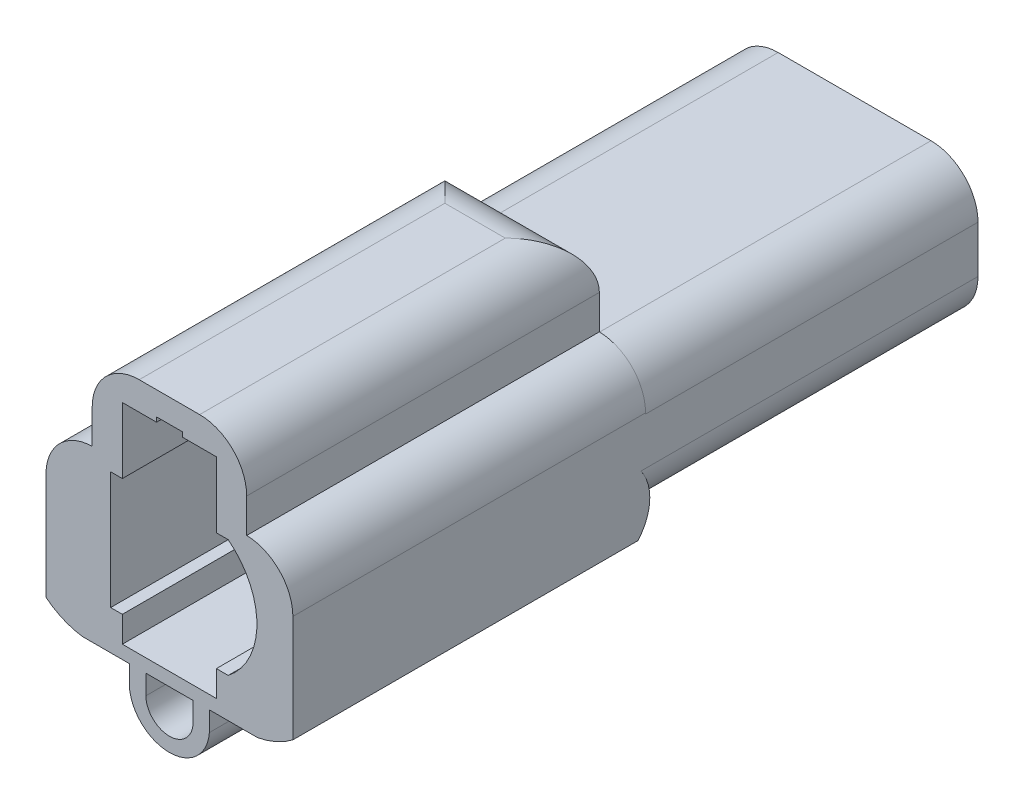
from build123d import *

# Parameters (mm, degrees)
SKETCH1_W            = 10.5
SKETCH1_H            = 6
BOSS_EXTRUDE1_DEPTH  = 7.07
SKETCH3_W            = 8.6
SKETCH3_H            = 1.8
CUT_EXTRUDE2_DEPTH   = 17
SKETCH4_W            = 10.5
SKETCH4_H            = 6
BOSS_EXTRUDE2_DEPTH  = 7.07
SKETCH5_W            = 4
SKETCH5_H            = 1.8
CUT_EXTRUDE3_DEPTH   = 19
FILLET1_R            = 12
FILLET2_R            = 12
SKETCH19_W           = 10.5
SKETCH19_H           = 11
SKETCH19_W_2         = 4
SKETCH19_H_2         = 1.8
BOSS_EXTRUDE8_DEPTH  = 15
CUT_EXTRUDE8_DEPTH   = 14.5
SKETCH21_W           = 10.5
SKETCH21_H           = 15
BOSS_EXTRUDE9_DEPTH  = 1
CUT_EXTRUDE10_DEPTH  = 15
FILLET6_R            = 2
FILLET12_R           = 2
BOSS_EXTRUDE15_DEPTH = 13
FILLET15_R           = 2
FILLET16_R           = 2
FILLET17_R           = 2


with BuildPart() as part:
    # Sketch1 → Boss-Extrude1 (new body)
    with BuildSketch(Plane.XY):
        Rectangle(SKETCH1_W, SKETCH1_H)
    extrude(amount=BOSS_EXTRUDE1_DEPTH)

    # Sketch3 → Cut-Extrude2 (cut)
    with BuildSketch(Plane.XY.offset(7.07)):
        Rectangle(SKETCH3_W, SKETCH3_H)
    extrude(amount=-CUT_EXTRUDE2_DEPTH, mode=Mode.SUBTRACT)

    # Sketch4 → Boss-Extrude2 (add)
    with BuildSketch(Plane.XY.offset(7.07)):
        Rectangle(SKETCH4_W, SKETCH4_H)
    extrude(amount=BOSS_EXTRUDE2_DEPTH)

    # Sketch5 → Cut-Extrude3 (cut, symmetric)
    with BuildSketch(Plane.XY.offset(14.14)):
        Rectangle(SKETCH5_W, SKETCH5_H)
    extrude(amount=CUT_EXTRUDE3_DEPTH, both=True, mode=Mode.SUBTRACT)

    # Fillet1
    # the kernel refuses this fillet: 12 mm, written as the material it takes off along each edge
    with BuildSketch(Plane(origin=(2, -0.9, 7.07), x_dir=(1, 0, 0), z_dir=(0, 1, 0))) as fillet1_piece_1:
        with BuildLine():
            CenterArc((12, -7.064700984), FILLET1_R, 143.93341174, 36.06658826)
            Line((0, -7.064700984), (0, 0))
            Line((0, 0), (2.3, 0))
        make_face()
    extrude(amount=1.8, mode=Mode.SUBTRACT)

    # Fillet2
    # the kernel refuses this fillet: 12 mm, written as the material it takes off along each edge
    with BuildSketch(Plane(origin=(-2, 0.9, 7.07), x_dir=(0, 0, 1), z_dir=(0, -1, 0))) as fillet2_piece_1:
        with BuildLine():
            CenterArc((7.064700984, 12), FILLET2_R, 233.93341174, 36.06658826)
            Line((0, 2.3), (0, 0))
            Line((0, 0), (7.064700984, 0))
        make_face()
    extrude(amount=1.8, mode=Mode.SUBTRACT)

    # Sketch19 → Boss-Extrude8 (add)
    with BuildSketch(Plane.XY.offset(14.14)):
        Rectangle(SKETCH19_W, SKETCH19_H)
        Rectangle(SKETCH19_W_2, SKETCH19_H_2, mode=Mode.SUBTRACT)
    extrude(amount=BOSS_EXTRUDE8_DEPTH)

    # Sketch20 → Cut-Extrude8 (cut)
    with BuildSketch(Plane.XY.offset(29.14)):
        with BuildLine():
            Line((1.996194266, 2.5), (1.996194266, 3.60169129))
            Line((1.996194266, 3.60169129), (1.996194266, 5.301713665))
            Line((1.996194266, 5.301713665), (0.55, 5.301713665))
            Line((0.55, 5.301713665), (0.55, 5.5))
            Line((0.55, 5.5), (-0.55, 5.5))
            Line((-0.55, 5.5), (-0.55, 5.301713665))
            Line((-0.55, 5.301713665), (-2.002287503, 5.301713665))
            Line((-2.002287503, 5.301713665), (-2.002287503, 2.5))
            Line((-2.002287503, 2.5), (-2.5, 2.5))
            Line((-2.5, 2.5), (-2.5, -2.5))
            Line((-2.5, -2.5), (-2.002287503, -2.5))
            Line((-2.002287503, -2.5), (-2.002287503, -3.60169129))
            Line((-2.002287503, -3.60169129), (0, -3.60169129))
            Line((0, -3.60169129), (1.996194266, -3.60169129))
            Line((1.996194266, -3.60169129), (1.996194266, -2.5))
            Line((1.996194266, -2.5), (2.5, -2.5))
            ThreePointArc((2.5, -2.5), (3.720567772, 0), (2.5, 2.5))
            Line((2.5, 2.5), (1.996194266, 2.5))
        make_face()
    extrude(amount=-CUT_EXTRUDE8_DEPTH, mode=Mode.SUBTRACT)

    # Sketch21 → Boss-Extrude9 (add)
    with BuildSketch(Plane(origin=(0, 5.5, 0), x_dir=(1, 0, 0), z_dir=(0, 1, 0))):
        with Locations((0, -21.64)):
            Rectangle(SKETCH21_W, SKETCH21_H)
    extrude(amount=BOSS_EXTRUDE9_DEPTH)

    # Sketch22 → Cut-Extrude10 (cut)
    with BuildSketch(Plane.XY.offset(29.14)):
        Polygon((3.285102714, 3.046335485), (5.25, 3.046335485), (5.25, 5.593635507), (5.25, 6.5), (3.747361829, 6.5), (3.285102714, 6.5), (3.285102714, 3.836641371), align=None)
        Polygon((-5.25, 5.593635507), (-5.25, 3.046335485), (-4.265605325, 3.046335485), (-3.285102714, 3.046335485), (-3.285102714, 4.03485795), (-3.285102714, 5.593635507), (-3.285102714, 6.5), (-5.25, 6.5), align=None)
        with BuildLine():
            Line((-5.25, -3.5), (-5.25, -5.5))
            Line((-5.25, -5.5), (5.25, -5.5))
            Line((5.25, -5.5), (5.25, -3.5))
            ThreePointArc((5.25, -3.5), (4.53848024, -3.923585886), (3.747361829, -4.16816109))
            Line((3.747361829, -4.16816109), (-3.701400921, -4.16816109))
            ThreePointArc((-3.701400921, -4.16816109), (-4.521026788, -3.939133518), (-5.25, -3.5))
        make_face()
    extrude(amount=-CUT_EXTRUDE10_DEPTH, mode=Mode.SUBTRACT)

    # Fillet6
    # the kernel refuses this fillet: 2 mm, written as the material it takes off along each edge
    with BuildSketch(Plane(origin=(8.294369106, -4.16816109, 14.14), x_dir=(0, 1, 0), z_dir=(-1, 0, 0))) as fillet6_piece_1:
        with BuildLine():
            CenterArc((2, -1.818802911), FILLET6_R, 114.577232298, 65.422767702)
            Line((0, -1.818802911), (-0.04, -1.818802911))
            Line((-0.04, -1.818802911), (-0.04, 0))
            Line((-0.04, 0), (0, 0.04))
            ThreePointArc((0, 0.04), (0.584080545, 0.04), (1.151524312, 0.036376058))
            Line((1.151524312, 0.036376058), (1.16816109, 0))
        make_face()
    extrude(amount=16.542777304, mode=Mode.SUBTRACT)

    # Fillet12
    fillet12_edges = [part.edges().sort_by_distance(p)[0] for p in [
        (5.25, -3, 7.07),
        (-5.25, -3, 7.07),
        (-5.25, 3, 7.07),
        (5.25, 3, 7.07),
    ]]
    fillet(fillet12_edges, radius=FILLET12_R)

    # Sketch24 → Boss-Extrude15 (add)
    with BuildSketch(Plane.XY.offset(29.14)):
        with BuildLine():
            Line((-1.004242215, -4.5), (-1.004242215, -5.004164362))
            ThreePointArc((-1.004242215, -5.004164362), (-0.001088997, -5.990129828), (1.002064221, -5.004164362))
            Line((1.002064221, -5.004164362), (1.002064221, -4.16816109))
            Line((1.002064221, -4.16816109), (1.699607491, -4.16816109))
            Line((1.699607491, -4.16816109), (1.699607491, -5.004164362))
            ThreePointArc((1.699607491, -5.004164362), (-0.003424292, -6.590087757), (-1.706456074, -5.004164362))
            Line((-1.706456074, -5.004164362), (-1.706456074, -4.16816109))
            Line((-1.706456074, -4.16816109), (-1.004242215, -4.16816109))
            Line((-1.004242215, -4.16816109), (-1.004242215, -4.5))
        make_face()
    extrude(amount=-BOSS_EXTRUDE15_DEPTH)

    # Fillet15
    fillet15_edges = [part.edges().sort_by_distance(p)[0] for p in [
        (0, 6.5, 14.14),
        (-3.285102714, 6.5, 21.64),
        (3.285102714, 6.5, 21.64),
    ]]
    fillet(fillet15_edges, radius=FILLET15_R)

    # Fillet16
    # the kernel refuses this fillet: 2 mm, written as the material it takes off along each edge
    with BuildSketch(Plane(origin=(5.25, 3.046335485, 34.14), x_dir=(-1, 0, 0), z_dir=(0, 0, -1))) as fillet16_piece_1_section:
        with BuildLine():
            CenterArc((FILLET16_R, -FILLET16_R), FILLET16_R, 90, 90)
            Line((0, -FILLET16_R), (0, 0))
            Line((0, 0), (FILLET16_R, 0))
        make_face()
    fillet16_piece_1 = extrude(amount=25, mode=Mode.PRIVATE)
    fillet16_piece_1 = split(fillet16_piece_1, bisect_by=Plane(origin=(3.285102714, 3.046335485, 34.14), z_dir=(1, 0, 0)), keep=Keep.TOP, mode=Mode.PRIVATE)
    add(fillet16_piece_1, mode=Mode.SUBTRACT)

    # Fillet17
    # the kernel refuses this fillet: 2 mm, written as the material it takes off along each edge
    with BuildSketch(Plane(origin=(-5.25, 3.046335485, 34.14), x_dir=(1, 0, 0), z_dir=(0, 0, -1))) as fillet17_piece_1_section:
        with BuildLine():
            CenterArc((FILLET17_R, FILLET17_R), FILLET17_R, 180, 90)
            Line((0, FILLET17_R), (0, 0))
            Line((0, 0), (FILLET17_R, 0))
        make_face()
    fillet17_piece_1 = extrude(amount=25, mode=Mode.PRIVATE)
    fillet17_piece_1 = split(fillet17_piece_1, bisect_by=Plane(origin=(-3.285102714, 3.046335485, 34.14), z_dir=(-1, 0, 0)), keep=Keep.TOP, mode=Mode.PRIVATE)
    add(fillet17_piece_1, mode=Mode.SUBTRACT)


solid = part.part
